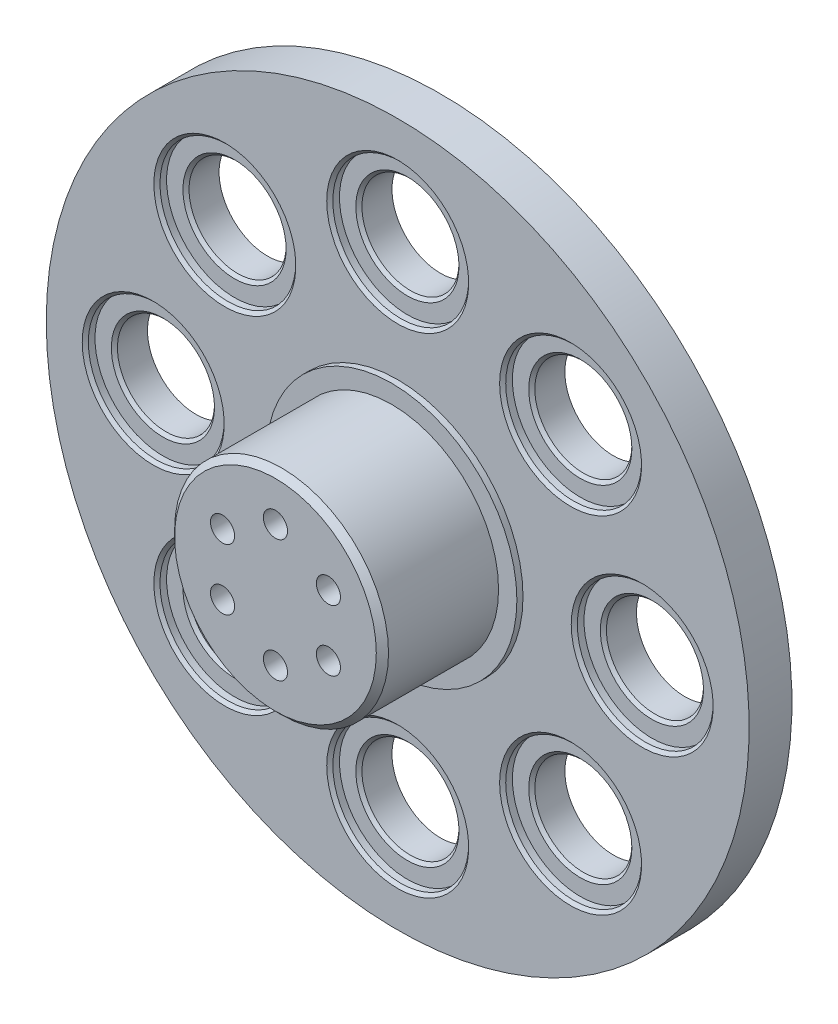
from build123d import *

# Parameters (mm, degrees)
SKETCH1_R           = 17.5
BOSS_EXTRUDE1_DEPTH = 19
SKETCH7_R           = 20.5
BOSS_EXTRUDE3_DEPTH = 1
SKETCH3_R           = 57.5
BOSS_EXTRUDE2_DEPTH = 7
SKETCH4_R           = 11
CUT_EXTRUDE1_DEPTH  = 7
SKETCH5_R           = 7.5
CUT_EXTRUDE2_DEPTH  = 0.5
SKETCH6_R           = 1.975
CUT_EXTRUDE3_DEPTH  = 10
CIRPATTERN1_COUNT   = 6
CHAMFER1_SIZE       = 1
SKETCH8_R           = 7.94
CUT_EXTRUDE4_DEPTH  = 84.740671122
SKETCH9_R           = 11.1125
CUT_EXTRUDE5_DEPTH  = 1.5875
CHAMFER2_SIZE       = 0.5
CHAMFER3_SIZE       = 0.5


with BuildPart() as part:
    # Sketch1 → Boss-Extrude1 (new body)
    with BuildSketch(Plane.XY):
        Circle(SKETCH1_R)
    extrude(amount=BOSS_EXTRUDE1_DEPTH)

    # Sketch7 → Boss-Extrude3 (add)
    with BuildSketch(Plane(origin=(0, 0, 0), x_dir=(-1, 0, 0), z_dir=(0, 0, -1))):
        Circle(SKETCH7_R)
    extrude(amount=BOSS_EXTRUDE3_DEPTH)

    # Sketch3 → Boss-Extrude2 (add)
    with BuildSketch(Plane(origin=(0, 0, -1), x_dir=(-1, 0, 0), z_dir=(0, 0, -1))):
        Circle(SKETCH3_R)
    extrude(amount=BOSS_EXTRUDE2_DEPTH)

    # Sketch4 → Cut-Extrude1 (cut)
    with BuildSketch(Plane(origin=(0, 0, -8), x_dir=(-1, 0, 0), z_dir=(0, 0, -1))):
        Circle(SKETCH4_R)
    extrude(amount=-CUT_EXTRUDE1_DEPTH, mode=Mode.SUBTRACT)

    # Sketch5 → Cut-Extrude2 (cut)
    with BuildSketch(Plane(origin=(0, 0, -1), x_dir=(-1, 0, 0), z_dir=(0, 0, -1))):
        Circle(SKETCH5_R)
    extrude(amount=-CUT_EXTRUDE2_DEPTH, mode=Mode.SUBTRACT)

    # Sketch6 → Cut-Extrude3 (cut)
    with BuildSketch(Plane.XY.offset(19)):
        with Locations((0, 10)):
            Circle(SKETCH6_R)
    cut_extrude3 = extrude(amount=-CUT_EXTRUDE3_DEPTH, mode=Mode.SUBTRACT)

    # CirPattern1: Cut-Extrude3 ×6 about axis
    cirpattern1_axis = Axis((0, 0, 19), (0, 0, 1))
    for i in range(1, CIRPATTERN1_COUNT):
        add(cut_extrude3.rotate(cirpattern1_axis, i * 360 / CIRPATTERN1_COUNT), mode=Mode.SUBTRACT)

    # Chamfer1
    chamfer1_edges = [part.edges().sort_by_distance(p)[0] for p in [
        (11, 0, -8),
        (-17.5, 0, 19),
    ]]
    chamfer(chamfer1_edges, length=CHAMFER1_SIZE)

    # Sketch8 → Cut-Extrude4 (cut, through all)
    with BuildSketch(Plane.XY.offset(-1)):
        with Locations((-40, 0)):
            Circle(SKETCH8_R)
        with Locations((-28.284271247, 28.284271247)):
            Circle(SKETCH8_R)
        with Locations((0, 40)):
            Circle(SKETCH8_R)
        with Locations((28.284271247, 28.284271247)):
            Circle(SKETCH8_R)
        with Locations((40, 0)):
            Circle(SKETCH8_R)
        with Locations((28.284271247, -28.284271247)):
            Circle(SKETCH8_R)
        with Locations((0, -40)):
            Circle(SKETCH8_R)
        with Locations((-28.284271247, -28.284271247)):
            Circle(SKETCH8_R)
    extrude(amount=-CUT_EXTRUDE4_DEPTH, mode=Mode.SUBTRACT)

    # Sketch9 → Cut-Extrude5 (cut)
    with BuildSketch(Plane.XY.offset(-1)):
        with Locations((0, 40)):
            Circle(SKETCH9_R)
        with Locations((28.284271247, 28.284271247)):
            Circle(SKETCH9_R)
        with Locations((40, 0)):
            Circle(SKETCH9_R)
        with Locations((28.284271247, -28.284271247)):
            Circle(SKETCH9_R)
        with Locations((0, -40)):
            Circle(SKETCH9_R)
        with Locations((-28.284271247, -28.284271247)):
            Circle(SKETCH9_R)
        with Locations((-40, 0)):
            Circle(SKETCH9_R)
        with Locations((-28.284271247, 28.284271247)):
            Circle(SKETCH9_R)
    extrude(amount=-CUT_EXTRUDE5_DEPTH, mode=Mode.SUBTRACT)

    # Chamfer2
    chamfer2_edges = [part.edges().sort_by_distance(p)[0] for p in [
        (-47.94, 0, -2.5875),
        (-36.224271247, -28.284271247, -2.5875),
        (-7.94, -40, -2.5875),
        (20.344271247, -28.284271247, -2.5875),
        (32.06, 0, -2.5875),
        (20.344271247, 28.284271247, -2.5875),
        (-36.224271247, 28.284271247, -2.5875),
        (-7.94, 40, -2.5875),
    ]]
    chamfer(chamfer2_edges, length=CHAMFER2_SIZE)

    # Chamfer3
    chamfer3_edges = [part.edges().sort_by_distance(p)[0] for p in [
        (-39.396771247, 28.284271247, -1),
        (-51.1125, 0, -1),
        (-39.396771247, -28.284271247, -1),
        (-11.1125, -40, -1),
        (17.171771247, -28.284271247, -1),
        (28.8875, 0, -1),
        (17.171771247, 28.284271247, -1),
        (-11.1125, 40, -1),
    ]]
    chamfer(chamfer3_edges, length=CHAMFER3_SIZE)


solid = part.part
